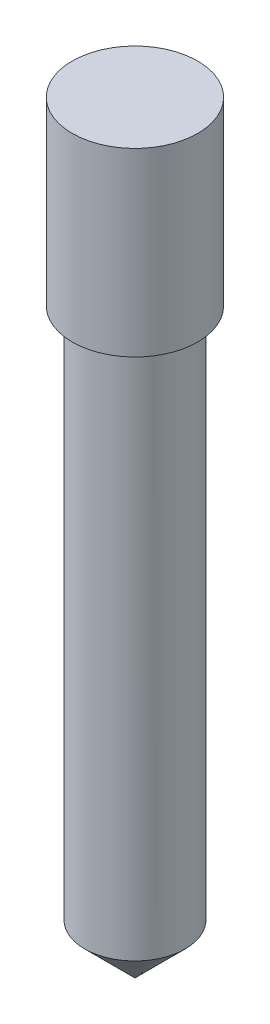
from build123d import *

# Parameters (mm, degrees)
SKETCH1_R           = 5
BOSS_EXTRUDE1_DEPTH = 58
CHAMFER1_SIZE       = 5
SKETCH2_R           = 6.25
BOSS_EXTRUDE2_DEPTH = 18


with BuildPart() as part:
    # Sketch1 → Boss-Extrude1 (new body)
    with BuildSketch(Plane(origin=(0, 0, 0), x_dir=(1, 0, 0), z_dir=(0, 1, 0))):
        Circle(SKETCH1_R)
    extrude(amount=BOSS_EXTRUDE1_DEPTH)

    # Chamfer1
    chamfer1_edges = [part.edges().sort_by_distance(p)[0] for p in [
        (-5, 0, 0),
    ]]
    chamfer(chamfer1_edges, length=CHAMFER1_SIZE)

    # Sketch2 → Boss-Extrude2 (add)
    with BuildSketch(Plane(origin=(0, 58, 0), x_dir=(1, 0, 0), z_dir=(0, 1, 0))):
        Circle(SKETCH2_R)
    extrude(amount=BOSS_EXTRUDE2_DEPTH)


solid = part.part
